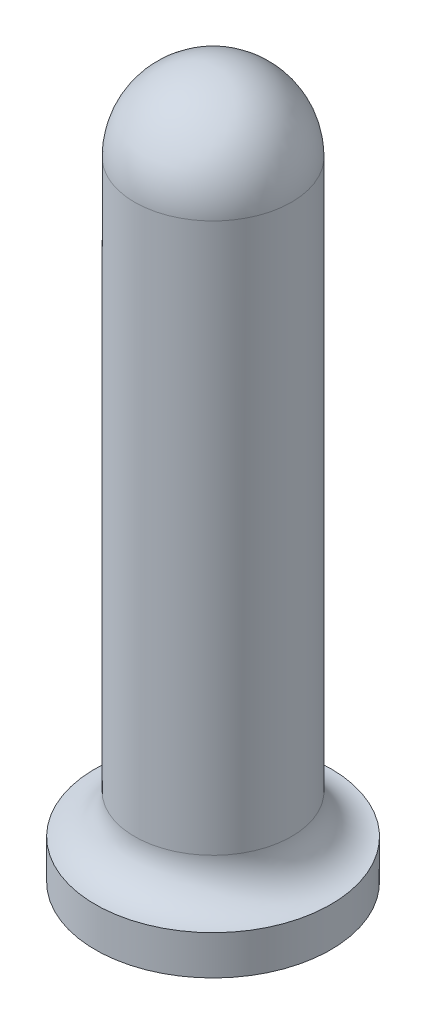
from build123d import *
from build123d.topology import SkipClean

# Parameters (mm, degrees)
SKETCH1_R           = 2
BOSS_EXTRUDE1_DEPTH = 15
SKETCH3_R           = 3
BOSS_EXTRUDE2_DEPTH = 1
FILLET3_R           = 1


with BuildPart() as part:
    # Sketch1 → Boss-Extrude1 (new body)
    with BuildSketch(Plane(origin=(0, 0, 0), x_dir=(1, 0, 0), z_dir=(0, 1, 0))):
        with Locations(Location((0, 0, 0), (0, 0, 270))):
            Circle(SKETCH1_R)
    extrude(amount=BOSS_EXTRUDE1_DEPTH)

    # Sketch2 → Revolve1 (revolve)
    with SkipClean():  # the faces are left unmerged after this step: merging them gives an invalid solid
        with BuildSketch(Plane.XY):
            with BuildLine():
                Line((2, 15), (-2, 15))
                ThreePointArc((-2, 15), (0, 17), (2, 15))
            make_face()
        revolve(axis=Axis((2, 15, 0), (-1, 0, 0)))

    # Sketch3 → Boss-Extrude2 (add)
    with BuildSketch(Plane.XZ):
        with Locations(Location((0, 0, 0), (0, 0, 270))):
            Circle(SKETCH3_R)
    extrude(amount=BOSS_EXTRUDE2_DEPTH)

    # Fillet3
    fillet3_edges = [part.edges().sort_by_distance(p)[0] for p in [
        (0, 0, -2),
    ]]
    fillet(fillet3_edges, radius=FILLET3_R - 0.0001)  # a hair under: the kernel refuses the full size


solid = part.part
